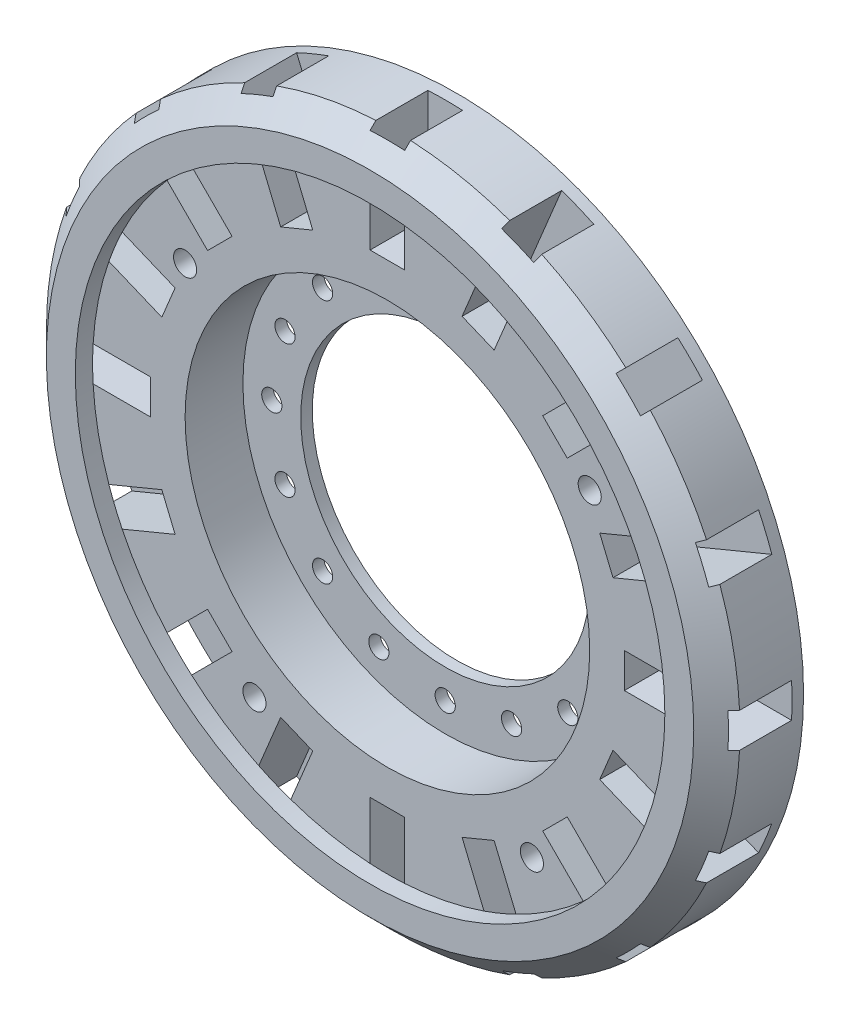
from build123d import *

# Parameters (mm, degrees)
SKETCH2_R           = 60
SKETCH2_R_2         = 35
BOSS_EXTRUDE1_DEPTH = 15
SKETCH3_R           = 51
CUT_EXTRUDE1_DEPTH  = 3
SKETCH4_W           = 6
SKETCH4_H           = 20
CUT_EXTRUDE2_DEPTH  = 10
CIRPATTERN1_COUNT   = 16
CHAMFER1_SIZE       = 4
SKETCH5_R           = 2
CUT_EXTRUDE3_DEPTH  = 86.697141143
SKETCH6_R           = 35
SKETCH6_R_2         = 1.75
SKETCH6_R_3         = 25
BOSS_EXTRUDE2_DEPTH = 2


with BuildPart() as part:
    # Sketch2 → Boss-Extrude1 (new body)
    with BuildSketch(Plane.XY):
        Circle(SKETCH2_R)
        Circle(SKETCH2_R_2, mode=Mode.SUBTRACT)
    extrude(amount=BOSS_EXTRUDE1_DEPTH)

    # Sketch3 → Cut-Extrude1 (cut)
    with BuildSketch(Plane.XY.offset(15)):
        Circle(SKETCH3_R)
    extrude(amount=-CUT_EXTRUDE1_DEPTH, mode=Mode.SUBTRACT)

    # Sketch4 → Cut-Extrude2 (cut)
    with BuildSketch(Plane.XY.offset(12)):
        with Locations((0, 51)):
            Rectangle(SKETCH4_W, SKETCH4_H)
    cut_extrude2 = extrude(amount=-CUT_EXTRUDE2_DEPTH, mode=Mode.SUBTRACT)

    # CirPattern1: Cut-Extrude2 ×16 about axis
    cirpattern1_axis = Axis((0, 0, 0), (0, 0, 1))
    for i in range(1, CIRPATTERN1_COUNT):
        add(cut_extrude2.rotate(cirpattern1_axis, i * 360 / CIRPATTERN1_COUNT), mode=Mode.SUBTRACT)

    # Chamfer1
    # the kernel refuses this chamfer: 4 mm, written as the material it takes off along each edge
    with BuildSketch(Plane(origin=(0, 0, 15), x_dir=(1, 0, 0), z_dir=(0, -1, 0))) as chamfer1_piece_1:
        Polygon((60, -CHAMFER1_SIZE), (60 - CHAMFER1_SIZE, 0), (60, 0), align=None)
    revolve(axis=Axis((0, 0, 15), (0, 0, 1)), mode=Mode.SUBTRACT)

    # Sketch5 → Cut-Extrude3 (cut, through all)
    with BuildSketch(Plane.XY.offset(12)):
        with Locations((25, -36)):
            Circle(SKETCH5_R)
        with Locations((-23, -36)):
            Circle(SKETCH5_R)
        with Locations((35, 24)):
            Circle(SKETCH5_R)
        with Locations((-35, 23)):
            Circle(SKETCH5_R)
    extrude(amount=-CUT_EXTRUDE3_DEPTH, mode=Mode.SUBTRACT)

    # Sketch6 → Boss-Extrude2 (add)
    with BuildSketch(Plane.XY):
        Circle(SKETCH6_R)
        with Locations((-30, 0)):
            Circle(SKETCH6_R_2, mode=Mode.SUBTRACT)
        Circle(SKETCH6_R_3, mode=Mode.SUBTRACT)
        with Locations((-27.716385975, 11.480502971)):
            Circle(SKETCH6_R_2, mode=Mode.SUBTRACT)
        with Locations((-21.213203436, 21.213203436)):
            Circle(SKETCH6_R_2, mode=Mode.SUBTRACT)
        with Locations((-11.480502971, 27.716385975)):
            Circle(SKETCH6_R_2, mode=Mode.SUBTRACT)
        with Locations((0, 30)):
            Circle(SKETCH6_R_2, mode=Mode.SUBTRACT)
        with Locations((11.480502971, 27.716385975)):
            Circle(SKETCH6_R_2, mode=Mode.SUBTRACT)
        with Locations((21.213203436, 21.213203436)):
            Circle(SKETCH6_R_2, mode=Mode.SUBTRACT)
        with Locations((27.716385975, 11.480502971)):
            Circle(SKETCH6_R_2, mode=Mode.SUBTRACT)
        with Locations((30, 0)):
            Circle(SKETCH6_R_2, mode=Mode.SUBTRACT)
        with Locations((27.716385975, -11.480502971)):
            Circle(SKETCH6_R_2, mode=Mode.SUBTRACT)
        with Locations((21.213203436, -21.213203436)):
            Circle(SKETCH6_R_2, mode=Mode.SUBTRACT)
        with Locations((11.480502971, -27.716385975)):
            Circle(SKETCH6_R_2, mode=Mode.SUBTRACT)
        with Locations((0, -30)):
            Circle(SKETCH6_R_2, mode=Mode.SUBTRACT)
        with Locations((-11.480502971, -27.716385975)):
            Circle(SKETCH6_R_2, mode=Mode.SUBTRACT)
        with Locations((-21.213203436, -21.213203436)):
            Circle(SKETCH6_R_2, mode=Mode.SUBTRACT)
        with Locations((-27.716385975, -11.480502971)):
            Circle(SKETCH6_R_2, mode=Mode.SUBTRACT)
    extrude(amount=BOSS_EXTRUDE2_DEPTH)


solid = part.part
